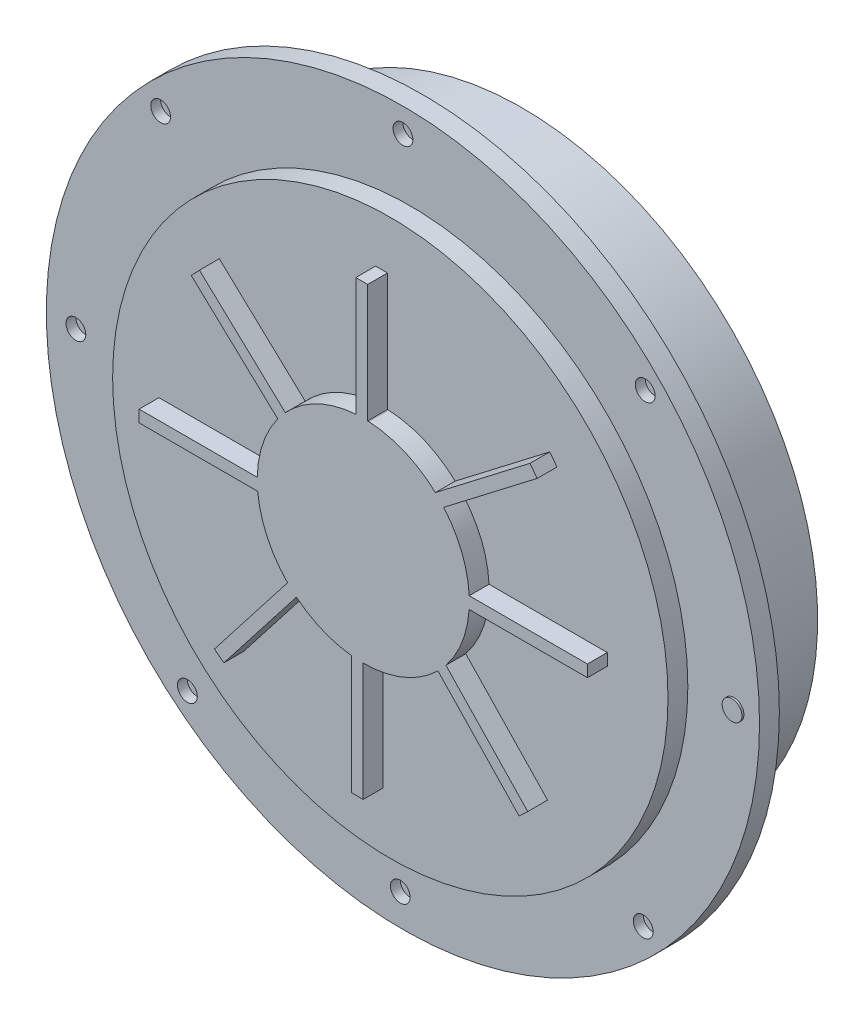
from build123d import *

# Parameters (mm, degrees)
SKETCH1_R                 = 37.862697854
BOSS_EXTRUDE1_DEPTH       = 12.7
SKETCH2_R                 = 45.662788003
BOSS_EXTRUDE2_DEPTH       = 2.54
BOSS_EXTRUDE5_DEPTH       = 5.08
SKETCH5_W                 = 1.524
SKETCH5_H                 = 15.24
BOSS_EXTRUDE7_DEPTH       = 5.08
SKETCH13_W                = 15.24
SKETCH13_H                = 1.524
BOSS_EXTRUDE11_DEPTH      = 5.08
SKETCH19_W                = 1.524
SKETCH19_H                = 15.24
BOSS_EXTRUDE15_DEPTH      = 5.08
SKETCH20_W                = 15.24
SKETCH20_H                = 1.524
BOSS_EXTRUDE16_DEPTH      = 5.08
BOSS_EXTRUDE18_DEPTH      = 5.08
BOSS_EXTRUDE19_DEPTH      = 5.08
BOSS_EXTRUDE20_DEPTH      = 5.08
BOSS_EXTRUDE23_DEPTH      = 5.08
SKETCH3_R                 = 1.27
CUT_EXTRUDE3_DEPTH        = 1.27
BOSS_EXTRUDE24_DEPTH      = 0.254
BOSS_EXTRUDE24_DEPTH_BACK = 0.254
SKETCH30_R                = 1.27
SKETCH31_R                = 1.27
CUT_EXTRUDE4_DEPTH        = 1.27
SKETCH32_R                = 1.27
CUT_EXTRUDE5_DEPTH        = 1.27
SKETCH33_R                = 1.27
CUT_EXTRUDE6_DEPTH        = 1.27
SKETCH34_R                = 1.27
CUT_EXTRUDE7_DEPTH        = 1.27
SKETCH35_R                = 1.27
CUT_EXTRUDE8_DEPTH        = 1.27
SKETCH36_R                = 1.27
CUT_EXTRUDE9_DEPTH        = 1.27
SKETCH23_R                = 35.56
BOSS_EXTRUDE25_DEPTH      = 2.54


with BuildPart() as part:
    # Sketch1 → Boss-Extrude1 (new body)
    with BuildSketch(Plane.XY):
        Circle(SKETCH1_R)
    extrude(amount=BOSS_EXTRUDE1_DEPTH)

    # Sketch2 → Boss-Extrude2 (add)
    with BuildSketch(Plane.XY.offset(12.7)):
        Circle(SKETCH2_R)
    extrude(amount=BOSS_EXTRUDE2_DEPTH)

    # Sketch4 → Boss-Extrude5 (add)
    with BuildSketch(Plane.XY.offset(15.24)):
        with BuildLine():
            Line((0.708239662, 13.564026433), (-0.708239662, 13.564026433))
            ThreePointArc((-0.708239662, 13.564026433), (-9.350528017, -9.851499494), (13.582504058, 0))
            ThreePointArc((13.582504058, 0), (9.851499494, 9.350528017), (0.708239662, 13.564026433))
        make_face()
    extrude(amount=BOSS_EXTRUDE5_DEPTH)

    # Sketch5 → Boss-Extrude7 (add)
    with BuildSketch(Plane.XY.offset(15.24)):
        with Locations((-0.199277737, 21.082)):
            Rectangle(SKETCH5_W, SKETCH5_H)
    extrude(amount=BOSS_EXTRUDE7_DEPTH)

    # Sketch13 → Boss-Extrude11 (add)
    with BuildSketch(Plane.XY.offset(15.24)):
        with Locations((21.082, -0.080355931)):
            Rectangle(SKETCH13_W, SKETCH13_H)
    extrude(amount=BOSS_EXTRUDE11_DEPTH)

    # Sketch19 → Boss-Extrude15 (add)
    with BuildSketch(Plane.XY.offset(15.24)):
        with Locations((-0.776533, -21.082)):
            Rectangle(SKETCH19_W, SKETCH19_H)
    extrude(amount=BOSS_EXTRUDE15_DEPTH)

    # Sketch20 → Boss-Extrude16 (add)
    with BuildSketch(Plane.XY.offset(15.24)):
        with Locations((-21.082, -0.520110833)):
            Rectangle(SKETCH20_W, SKETCH20_H)
    extrude(amount=BOSS_EXTRUDE16_DEPTH)

    # Sketch24 → Boss-Extrude18 (add)
    with BuildSketch(Plane.XY.offset(15.24)):
        Polygon((9.25361209, 9.96978177), (21.341880127, 19.250480874), (22.269950038, 18.041654071), (10.181682, 8.760954967), align=None)
    extrude(amount=BOSS_EXTRUDE18_DEPTH)

    # Sketch25 → Boss-Extrude19 (add)
    with BuildSketch(Plane.XY.offset(15.24)):
        Polygon((9.439019397, -9.530413486), (19.957833955, -20.558202942), (21.060612901, -19.506321486), (10.541798343, -8.47853203), align=None)
    extrude(amount=BOSS_EXTRUDE19_DEPTH)

    # Sketch26 → Boss-Extrude20 (add)
    with BuildSketch(Plane.XY.offset(15.24)):
        Polygon((-9.694999843, -9.512696491), (-19.057955954, -21.537365005), (-17.855489102, -22.473660616), (-8.492532991, -10.448992102), align=None)
    extrude(amount=BOSS_EXTRUDE20_DEPTH)

    # Sketch28 → Boss-Extrude23 (add)
    with BuildSketch(Plane.XY.offset(15.24)):
        Polygon((-10.897476186, 7.983069911), (-22.022907925, 18.398556872), (-20.981359228, 19.511100046), (-9.85592749, 9.095613085), align=None)
    extrude(amount=BOSS_EXTRUDE23_DEPTH)

    # Sketch3 → Cut-Extrude3 (cut)
    with BuildSketch(Plane.XY.offset(15.24)):
        with Locations((0, 42.566079665)):
            Circle(SKETCH3_R)
    extrude(amount=-CUT_EXTRUDE3_DEPTH, mode=Mode.SUBTRACT)

    # Sketch30 → Boss-Extrude24 (add, two sides: drawn at the far end of the back side and taken through both)
    with BuildSketch(Plane.XY.offset(15.24).offset(-BOSS_EXTRUDE24_DEPTH_BACK)):
        with Locations((42.395131554, 0)):
            Circle(SKETCH30_R)
    extrude(amount=BOSS_EXTRUDE24_DEPTH + BOSS_EXTRUDE24_DEPTH_BACK)

    # Sketch31 → Cut-Extrude4 (cut)
    with BuildSketch(Plane.XY.offset(15.24)):
        with Locations((-0.341896222, -41.625865054)):
            Circle(SKETCH31_R)
    extrude(amount=-CUT_EXTRUDE4_DEPTH, mode=Mode.SUBTRACT)

    # Sketch32 → Cut-Extrude5 (cut)
    with BuildSketch(Plane.XY.offset(15.24)):
        with Locations((-41.88228722, 0)):
            Circle(SKETCH32_R)
    extrude(amount=-CUT_EXTRUDE5_DEPTH, mode=Mode.SUBTRACT)

    # Sketch33 → Cut-Extrude6 (cut)
    with BuildSketch(Plane.XY.offset(15.24)):
        with Locations((31.027082165, 29.659497276)):
            Circle(SKETCH33_R)
    extrude(amount=-CUT_EXTRUDE6_DEPTH, mode=Mode.SUBTRACT)

    # Sketch34 → Cut-Extrude7 (cut)
    with BuildSketch(Plane.XY.offset(15.24)):
        with Locations((30.770659999, -29.915919443)):
            Circle(SKETCH34_R)
    extrude(amount=-CUT_EXTRUDE7_DEPTH, mode=Mode.SUBTRACT)

    # Sketch35 → Cut-Extrude8 (cut)
    with BuildSketch(Plane.XY.offset(15.24)):
        with Locations((-27.608119943, -32.992985443)):
            Circle(SKETCH35_R)
    extrude(amount=-CUT_EXTRUDE8_DEPTH, mode=Mode.SUBTRACT)

    # Sketch36 → Cut-Extrude9 (cut)
    with BuildSketch(Plane.XY.offset(15.24)):
        with Locations((-31.027082165, 29.574023221)):
            Circle(SKETCH36_R)
    extrude(amount=-CUT_EXTRUDE9_DEPTH, mode=Mode.SUBTRACT)

    # Sketch23 → Boss-Extrude25 (add)
    with BuildSketch(Plane.XY.offset(15.24)):
        with Locations((0.92271834, -0.494747233)):
            Circle(SKETCH23_R)
    extrude(amount=BOSS_EXTRUDE25_DEPTH)


solid = part.part
